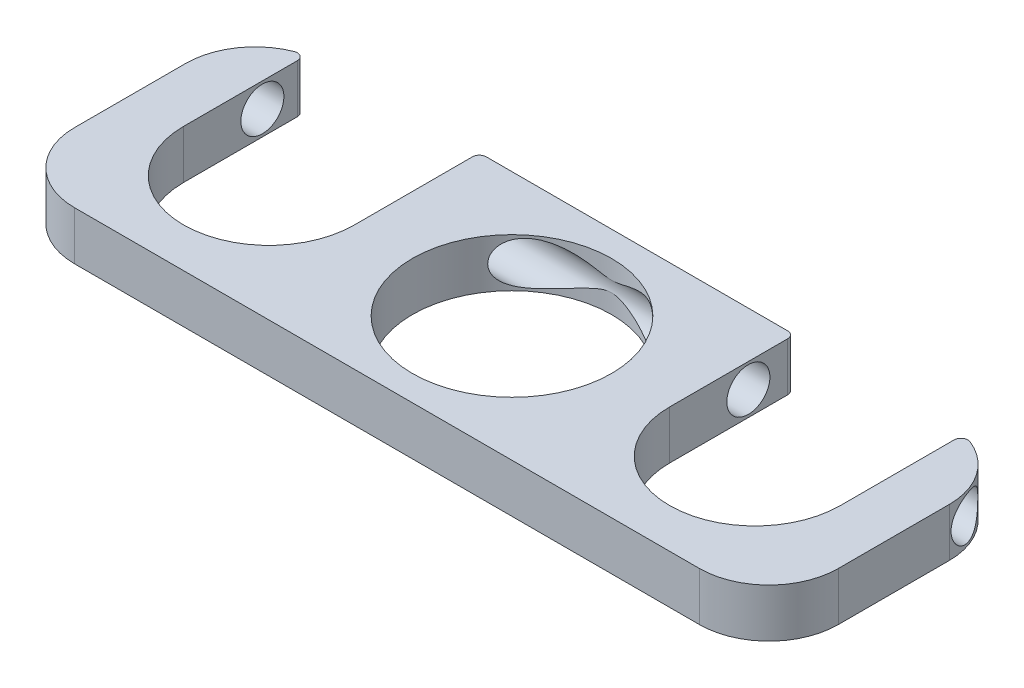
from build123d import *

# Parameters (mm, degrees)
SKETCH1_R               = 14.35
BOSS_EXTRUDE1_DEPTH     = 7
CUT_EXTRUDE1_DEPTH      = 10
CUT_EXTRUDE2_DEPTH      = 81.06428667
CUT_EXTRUDE2_DEPTH_BACK = 81.06428667
SKETCH3_R               = 3.1
FILLET2_R               = 1
FILLET3_R               = 1
FILLET5_R               = 1
FILLET7_R               = 1


with BuildPart() as part:
    # Sketch1 → Boss-Extrude1 (new body)
    with BuildSketch(Plane(origin=(0, 0, 0), x_dir=(1, 0, 0), z_dir=(0, 1, 0))):
        with BuildLine():
            Line((-45, -18), (45, -18))
            ThreePointArc((45, -18), (52.071067812, -15.071067812), (55, -8))
            Line((55, -8), (55, 8))
            ThreePointArc((55, 8), (52.071067812, 15.071067812), (45, 18))
            Line((45, 18), (-45, 18))
            ThreePointArc((-45, 18), (-52.071067812, 15.071067812), (-55, 8))
            Line((-55, 8), (-55, -8))
            ThreePointArc((-55, -8), (-52.071067812, -15.071067812), (-45, -18))
        make_face()
        Circle(SKETCH1_R, mode=Mode.SUBTRACT)
    extrude(amount=BOSS_EXTRUDE1_DEPTH)

    # Sketch2 → Cut-Extrude1 (cut)
    with BuildSketch(Plane(origin=(0, 7, 0), x_dir=(1, 0, 0), z_dir=(0, 1, 0))):
        with BuildLine():
            Line((-22.7, 0), (-22.7, 18))
            Line((-22.7, 18), (-47.3, 18))
            Line((-47.3, 18), (-47.3, 0))
            ThreePointArc((-47.3, 0), (-35, -12.3), (-22.7, 0))
        make_face()
    cut_extrude1 = extrude(amount=-CUT_EXTRUDE1_DEPTH, mode=Mode.SUBTRACT)

    # Sketch3 → Cut-Extrude2 (cut, two sides: drawn at the far end of the back side and taken through both)
    with BuildSketch(Plane.ZY.offset(22.7).offset(-CUT_EXTRUDE2_DEPTH_BACK)):
        with Locations((-11.34873736, 3.5)):
            Circle(SKETCH3_R)
    extrude(amount=CUT_EXTRUDE2_DEPTH + CUT_EXTRUDE2_DEPTH_BACK, mode=Mode.SUBTRACT)

    # Fillet2
    fillet2_edges = [part.edges().sort_by_distance(p)[0] for p in [
        (-47.3, 3.5, -17.731906288),
    ]]
    fillet(fillet2_edges, radius=FILLET2_R)

    # Fillet3
    fillet3_edges = [part.edges().sort_by_distance(p)[0] for p in [
        (-22.7, 3.5, -18),
    ]]
    fillet(fillet3_edges, radius=FILLET3_R)

    # Mirror5: Cut-Extrude1 across plane
    add(cut_extrude1.mirror(Plane.ZY), mode=Mode.SUBTRACT)

    # Fillet5
    fillet5_edges = [part.edges().sort_by_distance(p)[0] for p in [
        (47.3, 3.5, -17.731906288),
    ]]
    fillet(fillet5_edges, radius=FILLET5_R)

    # Fillet7
    fillet7_edges = [part.edges().sort_by_distance(p)[0] for p in [
        (22.7, 3.5, -18),
    ]]
    fillet(fillet7_edges, radius=FILLET7_R)


solid = part.part
